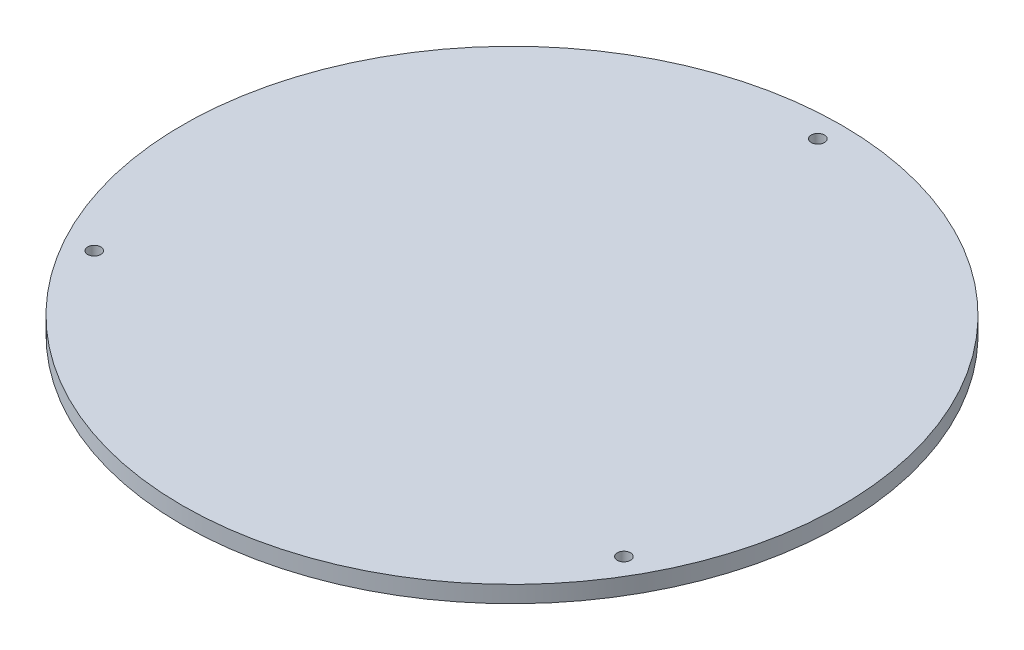
from build123d import *

# Parameters (mm, degrees)
SKETCH1_R           = 125
BOSS_EXTRUDE1_DEPTH = 6.35
SKETCH2_R           = 2.5
CUT_EXTRUDE1_DEPTH  = 177.890707783


with BuildPart() as part:
    # Sketch1 → Boss-Extrude1 (new body)
    with BuildSketch(Plane(origin=(0, 0, 0), x_dir=(1, 0, 0), z_dir=(0, 1, 0))):
        Circle(SKETCH1_R)
    extrude(amount=BOSS_EXTRUDE1_DEPTH)

    # Sketch2 → Cut-Extrude1 (cut, through all)
    with BuildSketch(Plane(origin=(0, 6.35, 0), x_dir=(1, 0, 0), z_dir=(0, 1, 0))):
        with Locations((0, 116)):
            Circle(SKETCH2_R)
        with Locations((100.458946839, -58)):
            Circle(SKETCH2_R)
        with Locations((-100.458946839, -58)):
            Circle(SKETCH2_R)
    extrude(amount=-CUT_EXTRUDE1_DEPTH, mode=Mode.SUBTRACT)


solid = part.part
